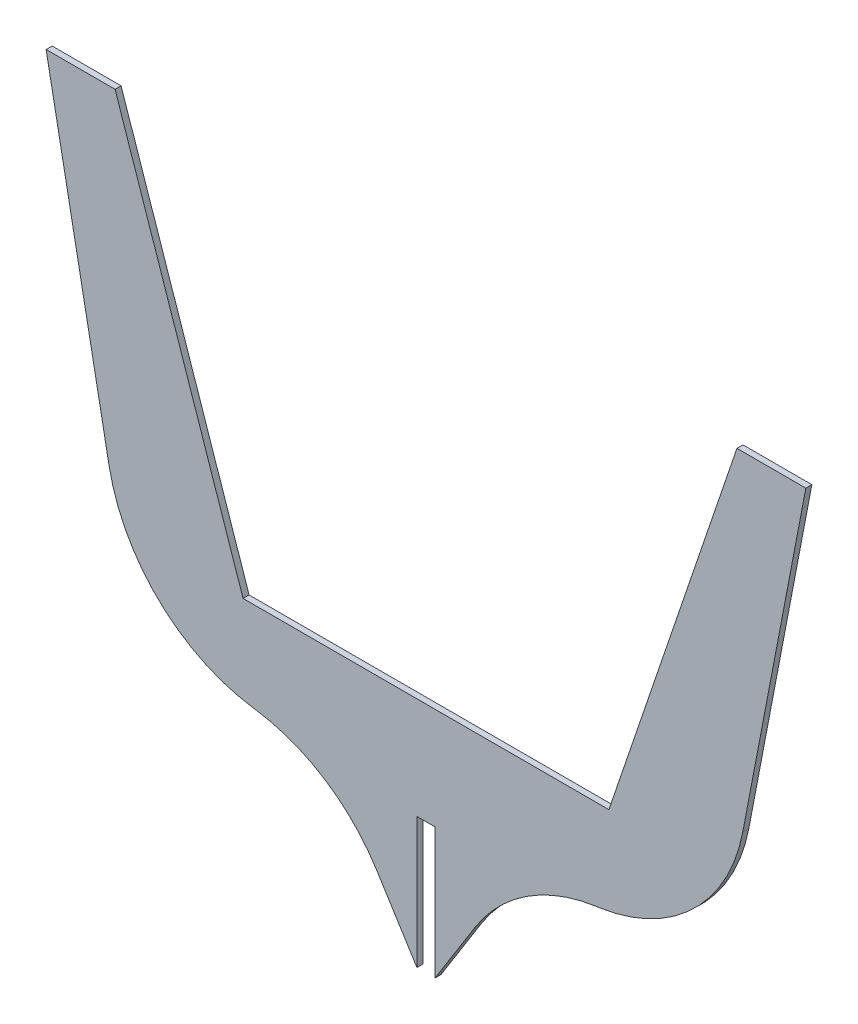
from build123d import *

# Parameters (mm, degrees)
BOSS_EXTRU_3_DEPTH = 3
CONG_2_R           = 85


with BuildPart() as part:
    # Esquisse3 → Boss.-Extru.3 (new body)
    with BuildSketch(Plane.XY):
        Polygon((-89.61281002, 1.004022038), (11.16230713, -13.926203114), (51.885284984, -78.926203114), (51.885284984, -13.926203114), (60.885284984, -13.926203114), (60.885284984, -78.926203114), (101.608262839, -13.926203114), (202.383379989, 1.004022038), (245.052829187, 223.873796886), (210.825087382, 223.873796886), (147.229762937, 36.664572693), (-34.459192969, 36.664572693), (-98.054517413, 223.873796886), (-132.282259218, 223.873796886), align=None)
    extrude(amount=BOSS_EXTRU_3_DEPTH)

    # Congé2
    cong_2_edges = [part.edges().sort_by_distance(p)[0] for p in [
        (11.16230713, -13.926203114, 1.5),
        (-89.61281002, 1.004022038, 1.5),
        (202.383379989, 1.004022038, 1.5),
        (101.608262839, -13.926203114, 1.5),
    ]]
    fillet(cong_2_edges, radius=CONG_2_R)


solid = part.part
